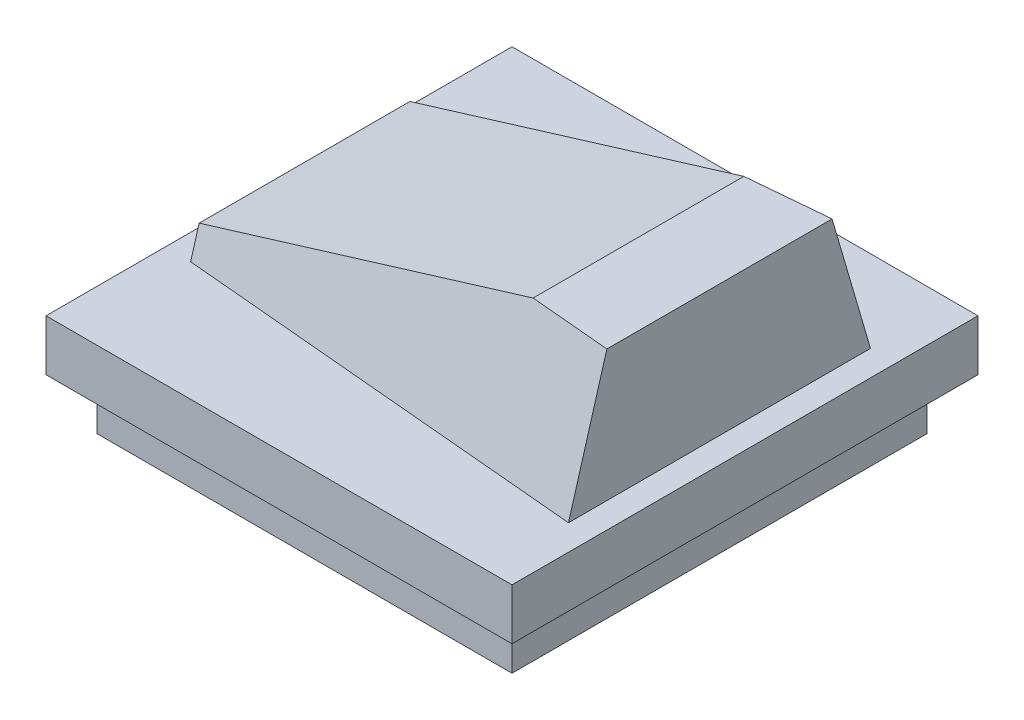
from build123d import *

# Parameters (mm, degrees)
SKETCH2_W           = 812.8
SKETCH2_H           = 812.8
BOSS_EXTRUDE1_DEPTH = 457.2
SKETCH3_W           = 912.8
SKETCH3_H           = 912.8
SKETCH3_W_2         = 812.8
SKETCH3_H_2         = 812.8
BOSS_EXTRUDE2_DEPTH = 100
CHAMFER4_SIZE       = 200
CHAMFER4_SIZE2      = 654.170523697
CHAMFER5_SIZE       = 200
CHAMFER5_SIZE_2     = 654.170523697


with BuildPart() as part:
    # Sketch2 → Boss-Extrude1 (new body)
    with BuildSketch(Plane(origin=(0, 0, 0), x_dir=(1, 0, 0), z_dir=(0, 1, 0))):
        with Locations((406.4, 406.4)):
            Rectangle(SKETCH2_W, SKETCH2_H)
    extrude(amount=BOSS_EXTRUDE1_DEPTH)

    # Sketch3 → Boss-Extrude2 (add)
    with BuildSketch(Plane(origin=(0, 100, 0), x_dir=(1, 0, 0), z_dir=(0, 1, 0))):
        with Locations((406.4, 406.4)):
            Rectangle(SKETCH3_W, SKETCH3_H)
        with Locations((406.4, 406.4)):
            Rectangle(SKETCH3_W_2, SKETCH3_H_2, mode=Mode.SUBTRACT)
    extrude(amount=BOSS_EXTRUDE2_DEPTH)

    # Chamfer4
    chamfer4_edges = [part.edges().sort_by_distance(p)[0] for p in [
        (0, 457.2, -406.4),
    ]]
    chamfer4_side = [part.faces().sort_by_distance(p)[0] for p in [
        (0, 328.6, -406.4),
    ]]
    chamfer(chamfer4_edges, length=CHAMFER4_SIZE, length2=CHAMFER4_SIZE2, reference=chamfer4_side[0])

    # Chamfer5
    # the kernel refuses this chamfer: 654.170523697, 200 mm, written as the material it takes off along each edge
    with BuildSketch(Plane(origin=(-1623.89408898, -239.27424644, -812.8), x_dir=(-0.03497993633861633, 0.11441421636757278, 0.9928170985366542), z_dir=(0.9563047559630362, 0.2923717047227344, 0))) as chamfer5_piece_1_section:
        Polygon((CHAMFER5_SIZE * 0.992817098537, CHAMFER5_SIZE * 0.119642002881), (-CHAMFER5_SIZE_2 * 0.11964200288, CHAMFER5_SIZE_2 * 0.992817098536), (0, 0), align=None)
    chamfer5_piece_1 = extrude(amount=4080.246048475, mode=Mode.PRIVATE)
    chamfer5_piece_1 = split(chamfer5_piece_1, bisect_by=Plane(origin=(478.445479778, 200, -727.207473948), z_dir=(0, 1, 0)), keep=Keep.TOP, mode=Mode.PRIVATE)
    add(chamfer5_piece_1, mode=Mode.SUBTRACT)
    with BuildSketch(Plane(origin=(-1623.89408898, -239.27424644, 0), x_dir=(0.2923531587775955, -0.9562440949098164, 0.011263281176818211), z_dir=(0.9563047559630362, 0.2923717047227344, 0))) as chamfer5_piece_2_section:
        Polygon((CHAMFER5_SIZE_2 * 0.999936567236, CHAMFER5_SIZE_2 * 0.0112632811768), (-CHAMFER5_SIZE * 0.0112632811768, CHAMFER5_SIZE * 0.999936567237), (0, 0), align=None)
    chamfer5_piece_2 = extrude(amount=4080.246048475, mode=Mode.PRIVATE)
    chamfer5_piece_2 = split(chamfer5_piece_2, bisect_by=Plane(origin=(478.445479778, 200, -85.592526052), z_dir=(0, 1, 0)), keep=Keep.TOP, mode=Mode.PRIVATE)
    add(chamfer5_piece_2, mode=Mode.SUBTRACT)


solid = part.part
